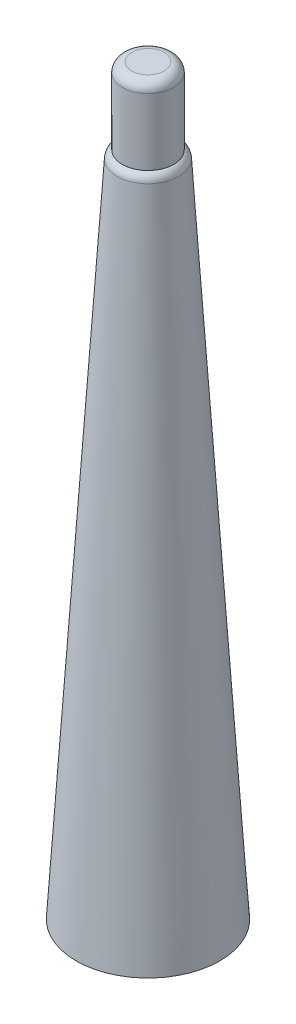
from build123d import *

# Parameters (mm, degrees)
SKETCH3_R           = 3.5814
CUT_EXTRUDE1_DEPTH  = 5.08
SKETCH4_R           = 6.850820799
BOSS_EXTRUDE1_DEPTH = 20.32
FILLET1_R           = 2.54


# Read off the part's stored shape, not the designer's step: Shell1
with BuildPart() as part:
    # Sketch2 → Revolve1 (revolve)
    with BuildSketch(Plane.XY):
        Polygon((0, 0), (-19.177, 0), (-8.084233452, 177.8), (0, 177.8), align=None)
    revolve(axis=Axis((0, 177.8, 0), (0, -1, 0)))

    # Sketch3 → Cut-Extrude1 (cut)
    with BuildSketch(Plane.XZ):
        Circle(SKETCH3_R)
    extrude(amount=-CUT_EXTRUDE1_DEPTH, mode=Mode.SUBTRACT)

    # Shell1 outline → Shell1 (revolve, cut)
    with BuildSketch(Plane.XY):
        Polygon((6.1214, 7.62), (6.1214, 2.54), (16.473593373, 2.54), (5.697763012, 175.26), (0, 175.26), (0, 7.62), align=None)
    revolve(axis=Axis((0, 0, 0), (0, 1, 0)), mode=Mode.SUBTRACT)

    # Sketch4 → Boss-Extrude1 (add)
    with BuildSketch(Plane(origin=(0, 177.8, 0), x_dir=(1, 0, 0), z_dir=(0, 1, 0))):
        with Locations(Location((0, 0, 0), (0, 0, 180))):
            Circle(SKETCH4_R)
    extrude(amount=BOSS_EXTRUDE1_DEPTH)

    # Fillet1
    # the kernel refuses this fillet: 2.54 mm, written as the material it takes off along each edge
    with BuildSketch(Plane(origin=(0, 198.12, 0), x_dir=(-1, 0, 0), z_dir=(0, 0, -1))) as fillet1_piece_1:
        with BuildLine():
            CenterArc((6.850820799 - FILLET1_R, -FILLET1_R), FILLET1_R, 0, 90)
            Line((6.850820799 - FILLET1_R, 0), (6.850820799 - FILLET1_R, FILLET1_R * 0.02))
            Line((6.850820799 - FILLET1_R, FILLET1_R * 0.02), (6.850820799 + FILLET1_R * 0.02, FILLET1_R * 0.02))
            Line((6.850820799 + FILLET1_R * 0.02, FILLET1_R * 0.02), (6.850820799 + FILLET1_R * 0.02, -FILLET1_R))
            Line((6.850820799 + FILLET1_R * 0.02, -FILLET1_R), (6.850820799, -FILLET1_R))
        make_face()
    revolve(axis=Axis((0, 198.12, 0), (0, 1, 0)), mode=Mode.SUBTRACT)
    with BuildSketch(Plane(origin=(0, 177.8, 0), x_dir=(-1, 0, 0), z_dir=(0, 0, 1))) as fillet1_piece_2:
        with BuildLine():
            CenterArc((5.679920823, 2.254017136), FILLET1_R, 297.450637113, 58.979362887)
            Line((6.850820799, 0), (6.874238798, -0.045080343))
            ThreePointArc((6.874238798, -0.045080343), (7.467527125, -0.0508), (8.084233452, -0.0508))
            Line((8.084233452, -0.0508), (8.134934873, -0.003163212))
            Line((8.134934873, -0.003163212), (8.265693295, 2.092693343))
            Line((8.265693295, 2.092693343), (8.214991874, 2.095856554))
        make_face()
    revolve(axis=Axis((0, 177.8, 0), (0, -1, 0)), mode=Mode.SUBTRACT)


solid = part.part
